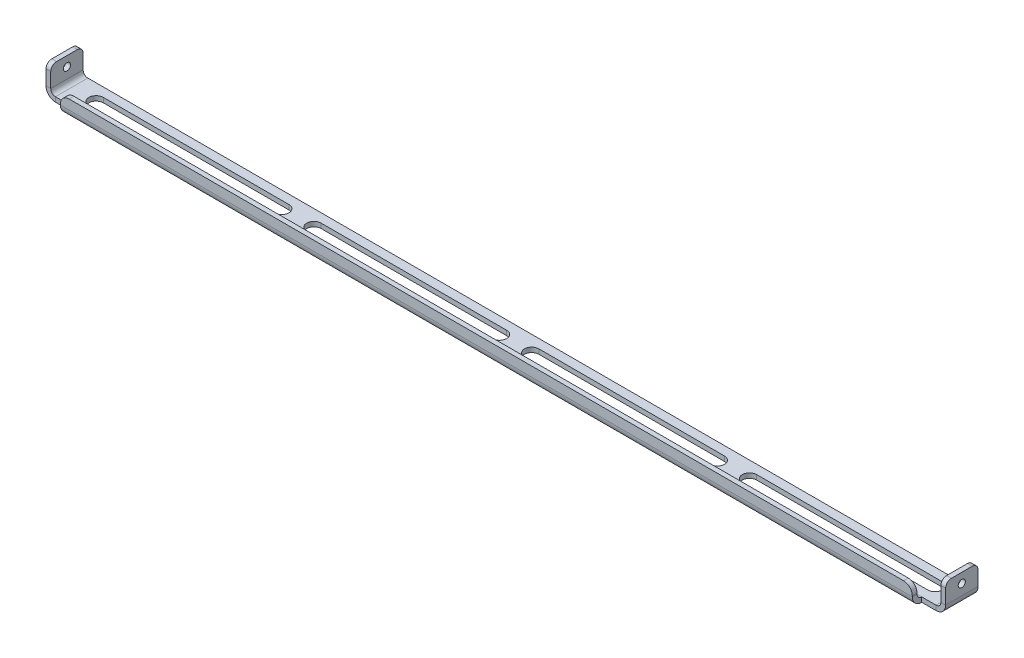
from build123d import *

# Parameters (mm, degrees)
SKETCH1_W                             = 312.6632
SKETCH1_H                             = 11.25
BASE_FLANGE1_DEPTH                    = 1.65
EDGE_FLANGE1_STRIP_W                  = 9.9
EDGE_FLANGE1_STRIP_H                  = 1.65
EDGE_FLANGE1_STRIP_CUT_DEPTH          = 11.25
EDGE_FLANGE1_STRIP_2_W                = 9.9
EDGE_FLANGE1_STRIP_2_H                = 1.65
EDGE_FLANGE1_STRIP_CUT_2_DEPTH        = 11.25
EDGE_FLANGE1_DEPTH                    = 11.25
EDGE_FLANGE1_BEND_DEPTH               = 11.25
TAP_DRILL_FOR_M3X0_5_TAP1_D           = 2.5
TAP_DRILL_FOR_M3X0_5_TAP1_ON_FACE_2_D = 2.5
FILLET1_R                             = 2
CUT_EXTRUDE1_REACH                    = 314.988
EDGE_FLANGE2_DEPTH                    = 296.0632
FILLET2_R                             = 3


# Sheet-metal steps are written as plain solids
with BuildPart() as part:
    # Sketch1 → Base-Flange1 (new body)
    with BuildSketch(Plane(origin=(0, 0, 0), x_dir=(1, 0, 0), z_dir=(0, 1, 0))):
        with Locations((156.3316, 5.625)):
            Rectangle(SKETCH1_W, SKETCH1_H)
    extrude(amount=-BASE_FLANGE1_DEPTH)

    # Edge-Flange1 strip (across the edge) → Edge-Flange1 strip cut (cut)
    with BuildSketch(Plane.XY.offset(-11.25)):
        with Locations((-1.65, -0.825)):
            Rectangle(EDGE_FLANGE1_STRIP_W, EDGE_FLANGE1_STRIP_H)
    extrude(amount=EDGE_FLANGE1_STRIP_CUT_DEPTH, mode=Mode.SUBTRACT)

    # Edge-Flange1 strip 2 (across the edge) → Edge-Flange1 strip cut 2 (cut)
    with BuildSketch(Plane(origin=(312.6632, 0, 0), x_dir=(-1, 0, 0), z_dir=(0, 0, -1))):
        with Locations((-1.65, -0.825)):
            Rectangle(EDGE_FLANGE1_STRIP_2_W, EDGE_FLANGE1_STRIP_2_H)
    extrude(amount=EDGE_FLANGE1_STRIP_CUT_2_DEPTH, mode=Mode.SUBTRACT)

    # Edge-Flange1 section (across the edge) → Edge-Flange1 (add)
    with BuildSketch(Plane.XY.offset(-11.25)):
        with BuildLine():
            Line((0, 1.65), (0, 8.75))
            Line((0, 8.75), (1.65, 8.75))
            Line((1.65, 8.75), (1.65, 1.65))
            ThreePointArc((1.65, 1.65), (2.133273811, 0.483273811), (3.3, 0))
            Line((3.3, 0), (3.3, -1.65))
            ThreePointArc((3.3, -1.65), (0.966547622, -0.683452378), (0, 1.65))
        make_face()
    extrude(amount=EDGE_FLANGE1_DEPTH)

    # Edge-Flange1 section 2 (across the edge) → Edge-Flange1 bend (add)
    with BuildSketch(Plane(origin=(312.6632, 0, 0), x_dir=(-1, 0, 0), z_dir=(0, 0, -1))):
        with BuildLine():
            Line((0, 1.65), (0, 8.75))
            Line((0, 8.75), (1.65, 8.75))
            Line((1.65, 8.75), (1.65, 1.65))
            ThreePointArc((1.65, 1.65), (2.133273811, 0.483273811), (3.3, 0))
            Line((3.3, 0), (3.3, -1.65))
            ThreePointArc((3.3, -1.65), (0.966547622, -0.683452378), (0, 1.65))
        make_face()
    extrude(amount=EDGE_FLANGE1_BEND_DEPTH)

    # Tap Drill for M3x0.5 Tap1 (through all)
    with Locations(Plane(origin=(312.6632, 5.375, -5.625), x_dir=(0, 1, 0), z_dir=(1, 0, 0))):
        with Locations((0, 0)):
            Hole(TAP_DRILL_FOR_M3X0_5_TAP1_D / 2)

    # Tap Drill for M3x0.5 Tap1 on face 2 (through all)
    with Locations(Plane(origin=(0, 5.375, -5.625), x_dir=(0, 0, -1), z_dir=(-1, 0, 0))):
        with Locations((0, 0)):
            Hole(TAP_DRILL_FOR_M3X0_5_TAP1_ON_FACE_2_D / 2)

    # Fillet1
    fillet1_edges = [part.edges().sort_by_distance(p)[0] for p in [
        (0.825, 8.75, -11.25),
        (0.825, 8.75, 0),
        (311.8382, 8.75, 0),
        (311.8382, 8.75, -11.25),
    ]]
    fillet(fillet1_edges, radius=FILLET1_R)

    # Sketch15 → Cut-Extrude1 (cut, up to next)
    with BuildSketch(Plane(origin=(0, 0, 0), x_dir=(1, 0, 0), z_dir=(0, 1, 0)), mode=Mode.PRIVATE) as cut_extrude1_sk1:
        with BuildLine():
            Line((11.8, 8.125), (76.3, 8.125))
            ThreePointArc((76.3, 8.125), (78.8, 5.625), (76.3, 3.125))
            Line((76.3, 3.125), (11.8, 3.125))
            ThreePointArc((11.8, 3.125), (9.3, 5.625), (11.8, 8.125))
        make_face()
    cut_extrude1_tool1 = extrude(cut_extrude1_sk1.sketch, amount=-CUT_EXTRUDE1_REACH, mode=Mode.PRIVATE) & part.part
    # Sketch15 → Cut-Extrude1 (cut, up to next)
    with BuildSketch(Plane(origin=(0, 0, 0), x_dir=(1, 0, 0), z_dir=(0, 1, 0)), mode=Mode.PRIVATE) as cut_extrude1_sk2:
        with BuildLine():
            Line((87.49, 8.125), (151.99, 8.125))
            ThreePointArc((151.99, 8.125), (154.49, 5.625), (151.99, 3.125))
            Line((151.99, 3.125), (87.49, 3.125))
            ThreePointArc((87.49, 3.125), (84.99, 5.625), (87.49, 8.125))
        make_face()
    cut_extrude1_tool2 = extrude(cut_extrude1_sk2.sketch, amount=-CUT_EXTRUDE1_REACH, mode=Mode.PRIVATE) & part.part
    # Sketch15 → Cut-Extrude1 (cut, up to next)
    with BuildSketch(Plane(origin=(0, 0, 0), x_dir=(1, 0, 0), z_dir=(0, 1, 0)), mode=Mode.PRIVATE) as cut_extrude1_sk3:
        with BuildLine():
            Line((163.18, 8.125), (227.68, 8.125))
            ThreePointArc((227.68, 8.125), (230.18, 5.625), (227.68, 3.125))
            Line((227.68, 3.125), (163.18, 3.125))
            ThreePointArc((163.18, 3.125), (160.68, 5.625), (163.18, 8.125))
        make_face()
    cut_extrude1_tool3 = extrude(cut_extrude1_sk3.sketch, amount=-CUT_EXTRUDE1_REACH, mode=Mode.PRIVATE) & part.part
    # Sketch15 → Cut-Extrude1 (cut, up to next)
    with BuildSketch(Plane(origin=(0, 0, 0), x_dir=(1, 0, 0), z_dir=(0, 1, 0)), mode=Mode.PRIVATE) as cut_extrude1_sk4:
        with BuildLine():
            Line((238.87, 8.125), (303.37, 8.125))
            ThreePointArc((303.37, 8.125), (305.87, 5.625), (303.37, 3.125))
            Line((303.37, 3.125), (238.87, 3.125))
            ThreePointArc((238.87, 3.125), (236.37, 5.625), (238.87, 8.125))
        make_face()
    cut_extrude1_tool4 = extrude(cut_extrude1_sk4.sketch, amount=-CUT_EXTRUDE1_REACH, mode=Mode.PRIVATE) & part.part
    add(cut_extrude1_tool1.solids().sort_by_distance((44.05, 0, -5.625))[0], mode=Mode.SUBTRACT)
    add(cut_extrude1_tool2.solids().sort_by_distance((119.74, 0, -5.625))[0], mode=Mode.SUBTRACT)
    add(cut_extrude1_tool3.solids().sort_by_distance((195.43, 0, -5.625))[0], mode=Mode.SUBTRACT)
    add(cut_extrude1_tool4.solids().sort_by_distance((271.12, 0, -5.625))[0], mode=Mode.SUBTRACT)

    # Edge-Flange2 section (across the edge) → Edge-Flange2 (add)
    with BuildSketch(Plane(origin=(8.3, 0, 1.65), x_dir=(0, 0, -1), z_dir=(1, 0, 0))):
        with BuildLine():
            Line((-1.65, 1.65), (-1.65, 5))
            Line((-1.65, 5), (0, 5))
            Line((0, 5), (0, 1.65))
            ThreePointArc((0, 1.65), (0.483273811, 0.483273811), (1.65, 0))
            Line((1.65, 0), (1.65, -1.65))
            ThreePointArc((1.65, -1.65), (-0.683452378, -0.683452378), (-1.65, 1.65))
        make_face()
    extrude(amount=EDGE_FLANGE2_DEPTH)

    # Fillet2
    fillet2_edges = [part.edges().sort_by_distance(p)[0] for p in [
        (8.3, 5, 2.475),
        (304.3632, 5, 2.475),
    ]]
    fillet(fillet2_edges, radius=FILLET2_R)


solid = part.part
